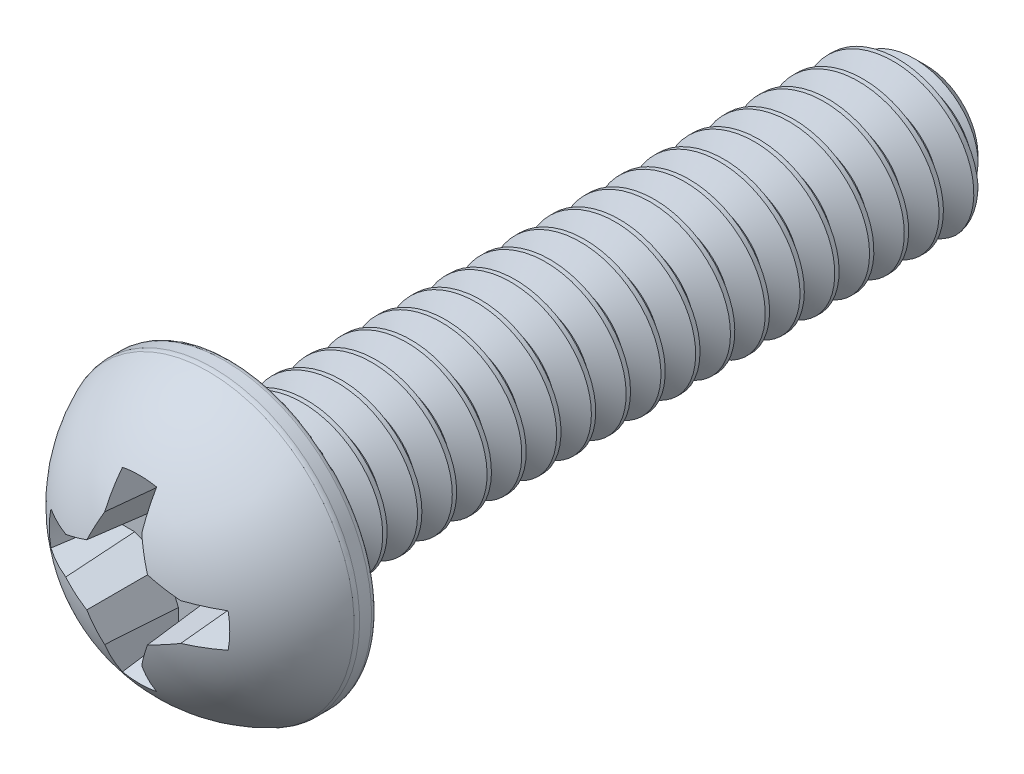
from build123d import *

# Parameters (mm, degrees)
SKETCH1_R          = 2.6796999999999995
EXTRUDE3_DEPTH     = 2.1844
CHAMFER1_SIZE      = 0.47625000000000006
CUT_SWEEP1_PITCH   = 0.6349999999999992
CUT_SWEEP1_TO      = 12.7
SKETCH26_R         = 0.5461
EXTRUDE8_DEPTH     = 2.132268765
CUT_EXTRUDE3_DEPTH = 1.4562666666666668
CIRPATTERN1_COUNT  = 4
DRAFT1_ANGLE       = 15.000000000000034
DRAFT2_ANGLE       = 5.000000000000011


with BuildPart() as part:
    # Sketch1 → Extrude3 (new body)
    with BuildSketch(Plane.XY):
        Circle(SKETCH1_R)
    extrude(amount=EXTRUDE3_DEPTH)

    # Sketch11 → Cut-Revolve3 (revolve, cut)
    with BuildSketch(Plane(origin=(0, 0, 0), x_dir=(0, 0, -1), z_dir=(1, 0, 0))):
        with BuildLine():
            Line((-2.4383999999999992, 3.1064199999999995), (-1.7e-16, 3.1064199999999995))
            Line((-1.7e-16, 3.1064199999999995), (-1e-16, 2.5704799999999994))
            ThreePointArc((-1e-16, 2.5704799999999994), (-0.03198979735880561, 2.647710202641194), (-0.1092200000000001, 2.679699999999999))
            Line((-0.1092200000000001, 2.679699999999999), (-0.3276600000000001, 2.679699999999999))
            ThreePointArc((-0.3276600000000001, 2.679699999999999), (-0.3706527055412052, 2.675427366492299), (-0.4119635572618461, 2.6627766093228997))
            ThreePointArc((-0.4119635572618461, 2.6627766093228997), (-1.7007743208814694, 1.599367860648657), (-2.1843999999999997, 1.1e-16))
            Line((-2.1843999999999997, 1.1e-16), (-2.4383999999999992, -3e-16))
            Line((-2.4383999999999992, -3e-16), (-2.4383999999999992, 3.1064199999999995))
        make_face()
    revolve(axis=Axis((0, 0, 0), (0, -1.2e-16, 1)), mode=Mode.SUBTRACT)



with BuildPart() as body_2:
    # Sketch4 → Revolve1 (revolve)
    with BuildSketch(Plane(origin=(0, 0, 0), x_dir=(0, 0, -1), z_dir=(1, 0, 0))):
        Polygon((0, 0), (12.7, 0), (12.7, 1.4224), (-1e-17, 1.4223999999999992), align=None)
    revolve(axis=Axis((0, 0, 0), (0, 0, -1)))

    # Chamfer1
    chamfer1_edges = [body_2.edges().sort_by_distance(p)[0] for p in [
        (1.7e-16, -1.4224, -12.7),
    ]]
    chamfer(chamfer1_edges, length=CHAMFER1_SIZE)

    # Cut-Sweep1: arcs per turn and ends read off the stored shape
    # Cut-Sweep1: the profile of Sketch14 profile screwed along a right-hand helix through 23 turns, 6 arcs to a turn; built about Z, then put on its axis
    cut_sweep1_z = Axis((0, 0, 0), (0, 0, 1))
    cut_sweep1_corners = [(1.4227, -4.97e-07, -0.158583743), (1.4227, -4.97e-07, -0.714541328), (0.992811128, -3.47e-07, -0.476250035), (0.992811128, -3.47e-07, -0.396875035)]
    with BuildLine(mode=Mode.PRIVATE) as cut_sweep1_profile:
        Line(cut_sweep1_corners[0], cut_sweep1_corners[1])
        Line(cut_sweep1_corners[1], cut_sweep1_corners[2])
        Line(cut_sweep1_corners[2], cut_sweep1_corners[3])
        Line(cut_sweep1_corners[3], cut_sweep1_corners[0])
    cut_sweep1_cap = Face(cut_sweep1_profile.wire())
    cut_sweep1_turn_angles = [0, 30, 60, 90, 120, 150, 180, 210, 240, 270, 300, 330, 360]
    cut_sweep1_turn_weights = [1, 0.8660254037844387, 1, 0.8660254037844387, 1, 0.8660254037844387, 1, 0.8660254037844387, 1, 0.8660254037844387, 1, 0.8660254037844387, 1]
    cut_sweep1_turn_rails = [Edge.make_bspline([Vector(p[0], p[1], 0).rotate(cut_sweep1_z, cut_sweep1_turn_angles[k]) / cut_sweep1_turn_weights[k] + Vector(0, 0, p[2] + CUT_SWEEP1_PITCH * cut_sweep1_turn_angles[k] / 360) for k in range(13)], [0, 0, 0, 1, 1, 2, 2, 3, 3, 4, 4, 5, 5, 6, 6, 6], 2, cut_sweep1_turn_weights) for p in cut_sweep1_corners]
    cut_sweep1_turn_sides = [Face.make_surface_from_curves(cut_sweep1_turn_rails[p[0]], cut_sweep1_turn_rails[p[1]]) for p in [(0, 1), (1, 2), (2, 3), (3, 0)]]
    cut_sweep1 = Plane(origin=(0, 0, -12.7), x_dir=(1, -3.49e-15, 0), z_dir=(0, 0, 1)) * split(Solid(Shell([*[p.moved(Location((0, 0, CUT_SWEEP1_PITCH * i))) for i in range(23) for p in cut_sweep1_turn_sides], cut_sweep1_cap, cut_sweep1_cap.rotate(cut_sweep1_z, 8280).moved(Location((0, 0, CUT_SWEEP1_PITCH * 8280 / 360)))])), bisect_by=Plane.XY.offset(CUT_SWEEP1_TO), keep=Keep.BOTTOM, mode=Mode.PRIVATE)
    add(cut_sweep1, mode=Mode.SUBTRACT)


with BuildPart() as part_1:
    add(part.part)

    add(body_2.part)  # Extrude8 merges body 2
    # Sketch26 → Extrude8 (add)
    with BuildSketch(Plane.XY):
        Circle(SKETCH26_R)
    extrude(amount=EXTRUDE8_DEPTH)

    # Sketch12 → Cut-Extrude3 (cut)
    with BuildSketch(Plane.XY.offset(2.1843999999999997)):
        with BuildLine():
            Line((1.7503727103296218, 0.35729333333333346), (1.0538330218314778, 0.3572933333333336))
            Line((1.0538330218314778, 0.3572933333333336), (0.5613050847288744, 0.5613050847288744))
            Line((0.5613050847288744, 0.5613050847288744), (0.35729333333333335, 1.0538330218314778))
            Line((0.35729333333333335, 1.0538330218314778), (0.35729333333333335, 1.7503727103296218))
            ThreePointArc((0.35729333333333335, 1.7503727103296218), (0.17955591032357107, 1.7774202728052206), (0, 1.7864666666666666))
            Line((0, 1.7864666666666666), (0, 3.3e-16))
            Line((0, 3.3e-16), (1.7864666666666662, 4.3e-16))
            ThreePointArc((1.7864666666666662, 4.3e-16), (1.7774202728052202, 0.17955591032357113), (1.7503727103296218, 0.35729333333333346))
        make_face()
    cut_extrude3 = extrude(amount=-CUT_EXTRUDE3_DEPTH, mode=Mode.SUBTRACT)

    # CirPattern1: Cut-Extrude3 ×4 about axis
    cirpattern1_axis = Axis((-2e-17, -2e-17, 0), (0, 0, 1))
    for i in range(1, CIRPATTERN1_COUNT):
        add(cut_extrude3.rotate(cirpattern1_axis, i * 360 / CIRPATTERN1_COUNT), mode=Mode.SUBTRACT)

    # Draft1
    draft1_faces = [part_1.faces().sort_by_distance(p)[0] for p in [
        (-1.7864666666666666, 3.99e-15, 1.1466272083675035),
        (-4.14e-15, -1.7864666666666666, 1.1466272083675042),
        (1.7864666666666666, -3.98e-15, 1.1466272083675038),
        (-1.3e-16, 1.786466666666666, 1.1466272083675029),
    ]]
    draft(draft1_faces, Plane.XY.offset(2.1843999999999997), DRAFT1_ANGLE)

    # Draft2
    draft2_faces = [part_1.faces().sort_by_distance(p)[0] for p in [
        (0.35729333333333335, 1.2684050568817975, 1.3407547378194864),
        (0.46076067394885706, 0.8040407648548038, 1.3776063614735639),
        (0.8040407648548039, 0.46076067394885706, 1.377606361473564),
        (1.2684050465917887, 0.3572933333333335, 1.3407546843529614),
        (1.268405046591789, -0.3572933333333337, 1.3407546843529614),
        (0.8040407648548037, -0.4607606739488573, 1.3776063614735643),
        (0.46076067394885695, -0.8040407648548039, 1.3776063614735643),
        (0.35729333333333324, -1.2684050465917887, 1.340754684352962),
        (-0.3572933333333336, -1.268405046591789, 1.3407546843529616),
        (-0.4607606739488572, -0.8040407648548038, 1.3776063614735643),
        (-0.804040764854804, -0.4607606739488571, 1.3776063614735643),
        (-1.2684050465917887, -0.35729333333333346, 1.3407546843529619),
        (-1.268405046591789, 0.3572933333333335, 1.3407546843529614),
        (-0.8040407648548038, 0.46076067394885717, 1.377606361473564),
        (-0.46076067394885706, 0.8040407648548039, 1.3776063614735639),
        (-0.35729333333333346, 1.268405046591787, 1.3407546843529592),
    ]]
    draft(draft2_faces, Plane.XY.offset(2.1843999999999997), DRAFT2_ANGLE)


solid = part_1.part
